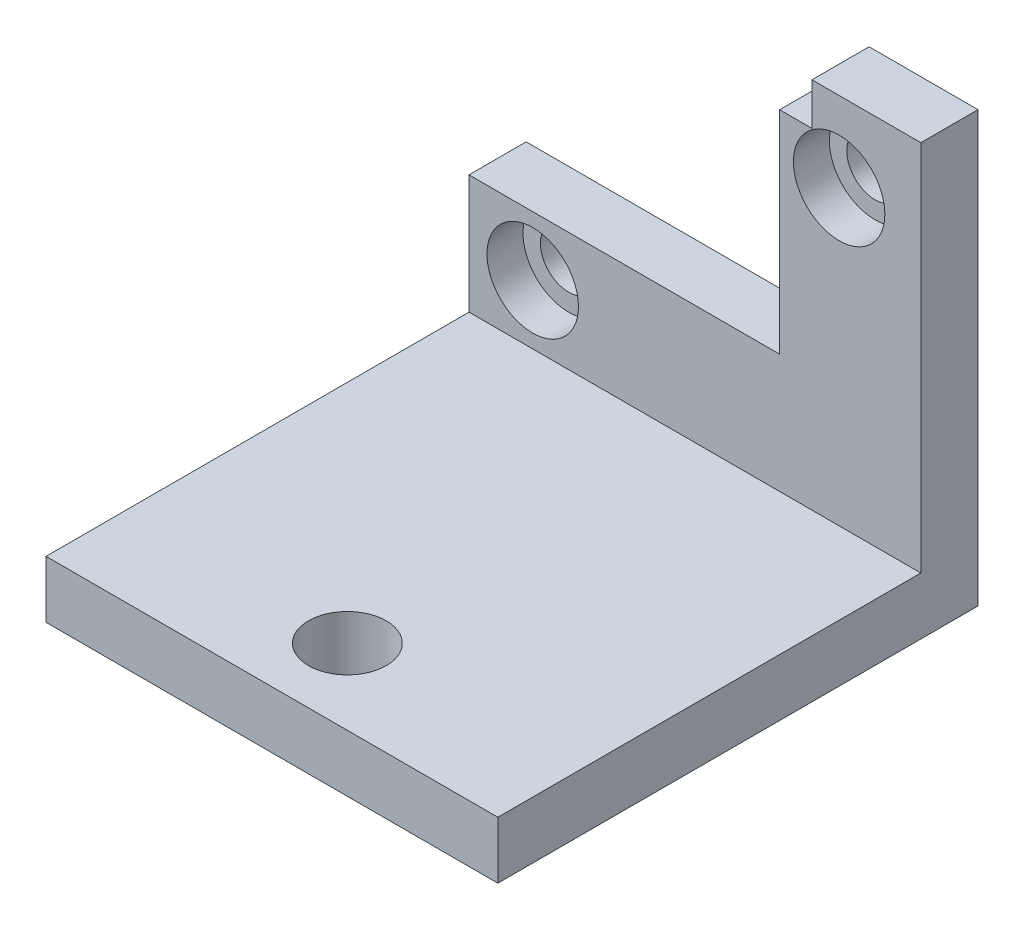
from build123d import *

# Parameters (mm, degrees)
SKETCH2_R           = 1.5748
BOSS_EXTRUDE1_DEPTH = 3.175
SKETCH3_W           = 25.098
SKETCH3_H           = 3.175
BOSS_EXTRUDE3_DEPTH = 26.67
SKETCH5_R           = 2.54
CUT_EXTRUDE2_DEPTH  = 2
SKETCH4_R           = 2.159
CUT_EXTRUDE3_DEPTH  = 39.036194564


with BuildPart() as part:
    # Sketch2 → Boss-Extrude1 (new body)
    with BuildSketch(Plane.XY):
        Polygon((4.395213829, 10.321811953), (4.395213829, -1.438404904), (-12.860786171, -1.438404904), (-12.860786171, -8.042404904), (12.237213829, -8.042404904), (12.237213829, 12.658595096), (6.188170382, 12.658595096), (6.188170382, 10.321811953), align=None)
        with Locations((-9.320786171, -4.740404904)):
            Circle(SKETCH2_R, mode=Mode.SUBTRACT)
        with Locations((7.697213829, 8.213595096)):
            Circle(SKETCH2_R, mode=Mode.SUBTRACT)
    extrude(amount=BOSS_EXTRUDE1_DEPTH)

    # Sketch3 → Boss-Extrude3 (add)
    with BuildSketch(Plane(origin=(0, 0, 0), x_dir=(-1, 0, 0), z_dir=(0, 0, -1))):
        with Locations((0.311786171, -9.629904904)):
            Rectangle(SKETCH3_W, SKETCH3_H)
    extrude(amount=-BOSS_EXTRUDE3_DEPTH)

    # Sketch5 → Cut-Extrude2 (cut)
    with BuildSketch(Plane.XY.offset(3.175)):
        with Locations((7.697213829, 8.213595096)):
            Circle(SKETCH5_R)
        with Locations((-9.320786171, -4.740404904)):
            Circle(SKETCH5_R)
    extrude(amount=-CUT_EXTRUDE2_DEPTH, mode=Mode.SUBTRACT)

    # Sketch4 → Cut-Extrude3 (cut, through all)
    with BuildSketch(Plane.XZ.offset(11.217404904)):
        with Locations((-0.311786171, 22.479)):
            Circle(SKETCH4_R)
    extrude(amount=-CUT_EXTRUDE3_DEPTH, mode=Mode.SUBTRACT)


solid = part.part
